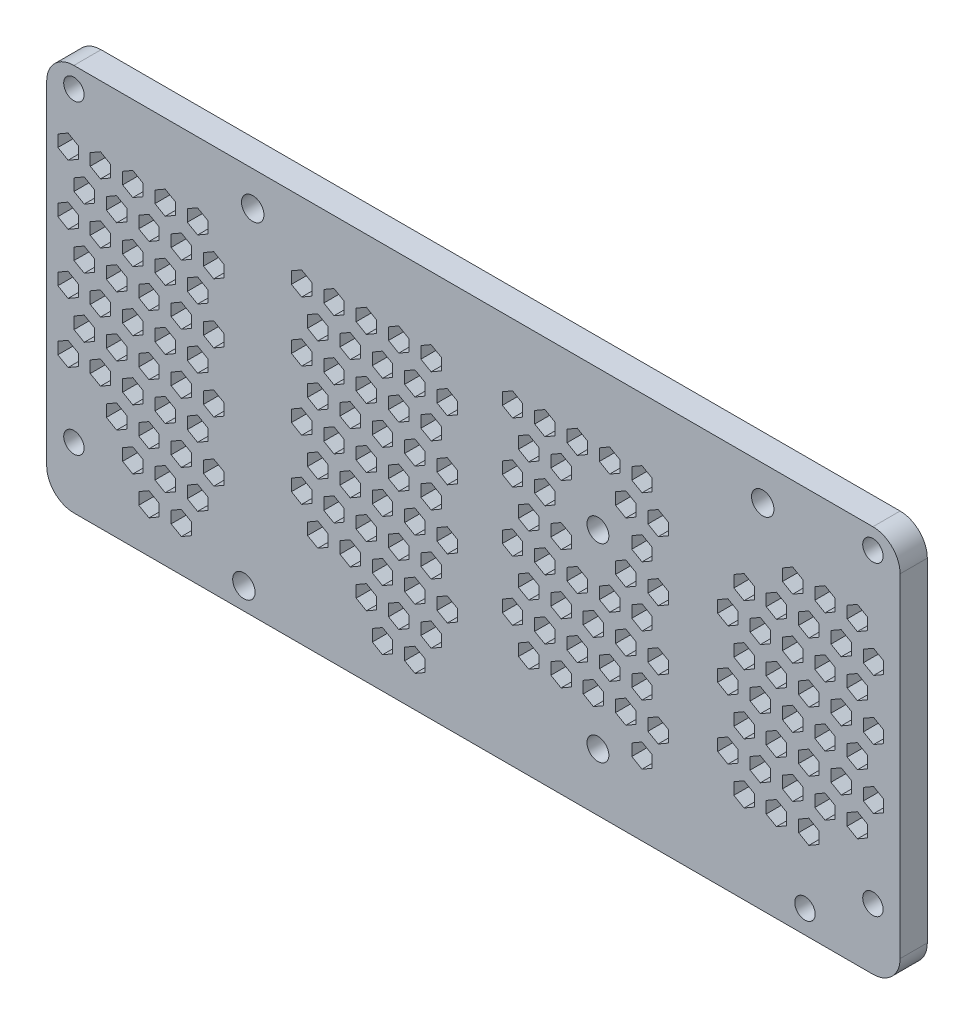
from build123d import *

# Parameters (mm, degrees)
SKETCH1_R           = 1.5
SKETCH1_R_2         = 1.65
SKETCH1_R_3         = 1.6081
BOSS_EXTRUDE5_DEPTH = 4


with BuildPart() as part:
    # Sketch1 → Boss-Extrude5 (new body)
    with BuildSketch(Plane.XY):
        with BuildLine():
            Line((-44, 22.584801725), (73.5, 22.584801725))
            ThreePointArc((73.5, 22.584801725), (76.328427125, 21.41322885), (77.5, 18.584801725))
            Line((77.5, 18.584801725), (77.5, -30.415198275))
            ThreePointArc((77.5, -30.415198275), (76.328427125, -33.2436254), (73.5, -34.415198275))
            Line((73.5, -34.415198275), (-44, -34.415198275))
            ThreePointArc((-44, -34.415198275), (-46.828427125, -33.2436254), (-48, -30.415198275))
            Line((-48, -30.415198275), (-48, 18.584801725))
            ThreePointArc((-48, 18.584801725), (-46.828427125, 21.41322885), (-44, 22.584801725))
        make_face()
        with Locations((-44, 19.584801725)):
            Circle(SKETCH1_R, mode=Mode.SUBTRACT)
        with Locations((73.5, 19.584801725)):
            Circle(SKETCH1_R, mode=Mode.SUBTRACT)
        with Locations((-44, -25.415198275)):
            Circle(SKETCH1_R, mode=Mode.SUBTRACT)
        with Locations((73.5, -25.415198275)):
            Circle(SKETCH1_R, mode=Mode.SUBTRACT)
        with Locations((-17.7, 17.511359812)):
            Circle(SKETCH1_R_2, mode=Mode.SUBTRACT)
        with Locations((-19, -31.188640188)):
            Circle(SKETCH1_R_2, mode=Mode.SUBTRACT)
        with Locations((57.3, 17.511359812)):
            Circle(SKETCH1_R_2, mode=Mode.SUBTRACT)
        with Locations((63.5088, -31.010440188)):
            Circle(SKETCH1_R, mode=Mode.SUBTRACT)
        with Locations((33.0607, -25.932240188)):
            Circle(SKETCH1_R_3, mode=Mode.SUBTRACT)
        with Locations((33.0607, 1.976659812)):
            Circle(SKETCH1_R_3, mode=Mode.SUBTRACT)
        Polygon((-44.8542361, 13.546846171), (-46.3542361, 12.680820767), (-46.3542361, 10.948769959), (-44.8542361, 10.082744555), (-43.3542361, 10.948769959), (-43.3542361, 12.680820767), align=None, mode=Mode.SUBTRACT)
        Polygon((-42.478591753, 9.144922382), (-43.978591753, 8.278896978), (-43.978591753, 6.546846171), (-42.478591753, 5.680820767), (-40.978591753, 6.546846171), (-40.978591753, 8.278896978), align=None, mode=Mode.SUBTRACT)
        Polygon((-40.0942361, 13.546846171), (-41.5942361, 12.680820767), (-41.5942361, 10.948769959), (-40.0942361, 10.082744555), (-38.5942361, 10.948769959), (-38.5942361, 12.680820767), align=None, mode=Mode.SUBTRACT)
        Polygon((-37.718591753, 9.144922382), (-39.218591753, 8.278896978), (-39.218591753, 6.546846171), (-37.718591753, 5.680820767), (-36.218591753, 6.546846171), (-36.218591753, 8.278896978), align=None, mode=Mode.SUBTRACT)
        Polygon((-35.3342361, 13.546846171), (-36.8342361, 12.680820767), (-36.8342361, 10.948769959), (-35.3342361, 10.082744555), (-33.8342361, 10.948769959), (-33.8342361, 12.680820767), align=None, mode=Mode.SUBTRACT)
        Polygon((-32.958591753, 9.144922382), (-34.458591753, 8.278896978), (-34.458591753, 6.546846171), (-32.958591753, 5.680820767), (-31.458591753, 6.546846171), (-31.458591753, 8.278896978), align=None, mode=Mode.SUBTRACT)
        Polygon((-30.5742361, 13.546846171), (-32.0742361, 12.680820767), (-32.0742361, 10.948769959), (-30.5742361, 10.082744555), (-29.0742361, 10.948769959), (-29.0742361, 12.680820767), align=None, mode=Mode.SUBTRACT)
        Polygon((-28.198591753, 9.144922382), (-29.698591753, 8.278896978), (-29.698591753, 6.546846171), (-28.198591753, 5.680820767), (-26.698591753, 6.546846171), (-26.698591753, 8.278896978), align=None, mode=Mode.SUBTRACT)
        Polygon((-25.8142361, 13.546846171), (-27.3142361, 12.680820767), (-27.3142361, 10.948769959), (-25.8142361, 10.082744555), (-24.3142361, 10.948769959), (-24.3142361, 12.680820767), align=None, mode=Mode.SUBTRACT)
        Polygon((-23.438591753, 9.144922382), (-24.938591753, 8.278896978), (-24.938591753, 6.546846171), (-23.438591753, 5.680820767), (-21.938591753, 6.546846171), (-21.938591753, 8.278896978), align=None, mode=Mode.SUBTRACT)
        Polygon((-40.0942361, 4.746846171), (-41.5942361, 3.880820767), (-41.5942361, 2.148769959), (-40.0942361, 1.282744555), (-38.5942361, 2.148769959), (-38.5942361, 3.880820767), align=None, mode=Mode.SUBTRACT)
        Polygon((-37.718591753, 0.344922382), (-39.218591753, -0.521103022), (-39.218591753, -2.253153829), (-37.718591753, -3.119179233), (-36.218591753, -2.253153829), (-36.218591753, -0.521103022), align=None, mode=Mode.SUBTRACT)
        Polygon((-35.3342361, 4.746846171), (-36.8342361, 3.880820767), (-36.8342361, 2.148769959), (-35.3342361, 1.282744555), (-33.8342361, 2.148769959), (-33.8342361, 3.880820767), align=None, mode=Mode.SUBTRACT)
        Polygon((-32.958591753, 0.344922382), (-34.458591753, -0.521103022), (-34.458591753, -2.253153829), (-32.958591753, -3.119179233), (-31.458591753, -2.253153829), (-31.458591753, -0.521103022), align=None, mode=Mode.SUBTRACT)
        Polygon((-30.5742361, 4.746846171), (-32.0742361, 3.880820767), (-32.0742361, 2.148769959), (-30.5742361, 1.282744555), (-29.0742361, 2.148769959), (-29.0742361, 3.880820767), align=None, mode=Mode.SUBTRACT)
        Polygon((-28.198591753, 0.344922382), (-29.698591753, -0.521103022), (-29.698591753, -2.253153829), (-28.198591753, -3.119179233), (-26.698591753, -2.253153829), (-26.698591753, -0.521103022), align=None, mode=Mode.SUBTRACT)
        Polygon((-25.8142361, 4.746846171), (-27.3142361, 3.880820767), (-27.3142361, 2.148769959), (-25.8142361, 1.282744555), (-24.3142361, 2.148769959), (-24.3142361, 3.880820767), align=None, mode=Mode.SUBTRACT)
        Polygon((-23.438591753, 0.344922382), (-24.938591753, -0.521103022), (-24.938591753, -2.253153829), (-23.438591753, -3.119179233), (-21.938591753, -2.253153829), (-21.938591753, -0.521103022), align=None, mode=Mode.SUBTRACT)
        Polygon((-40.0942361, -4.053153829), (-41.5942361, -4.919179233), (-41.5942361, -6.651230041), (-40.0942361, -7.517255445), (-38.5942361, -6.651230041), (-38.5942361, -4.919179233), align=None, mode=Mode.SUBTRACT)
        Polygon((-37.718591753, -8.455077618), (-39.218591753, -9.321103022), (-39.218591753, -11.053153829), (-37.718591753, -11.919179233), (-36.218591753, -11.053153829), (-36.218591753, -9.321103022), align=None, mode=Mode.SUBTRACT)
        Polygon((-35.3342361, -4.053153829), (-36.8342361, -4.919179233), (-36.8342361, -6.651230041), (-35.3342361, -7.517255445), (-33.8342361, -6.651230041), (-33.8342361, -4.919179233), align=None, mode=Mode.SUBTRACT)
        Polygon((-32.958591753, -8.455077618), (-34.458591753, -9.321103022), (-34.458591753, -11.053153829), (-32.958591753, -11.919179233), (-31.458591753, -11.053153829), (-31.458591753, -9.321103022), align=None, mode=Mode.SUBTRACT)
        Polygon((-30.5742361, -4.053153829), (-32.0742361, -4.919179233), (-32.0742361, -6.651230041), (-30.5742361, -7.517255445), (-29.0742361, -6.651230041), (-29.0742361, -4.919179233), align=None, mode=Mode.SUBTRACT)
        Polygon((-28.198591753, -8.455077618), (-29.698591753, -9.321103022), (-29.698591753, -11.053153829), (-28.198591753, -11.919179233), (-26.698591753, -11.053153829), (-26.698591753, -9.321103022), align=None, mode=Mode.SUBTRACT)
        Polygon((-25.8142361, -4.053153829), (-27.3142361, -4.919179233), (-27.3142361, -6.651230041), (-25.8142361, -7.517255445), (-24.3142361, -6.651230041), (-24.3142361, -4.919179233), align=None, mode=Mode.SUBTRACT)
        Polygon((-23.438591753, -8.455077618), (-24.938591753, -9.321103022), (-24.938591753, -11.053153829), (-23.438591753, -11.919179233), (-21.938591753, -11.053153829), (-21.938591753, -9.321103022), align=None, mode=Mode.SUBTRACT)
        Polygon((-40.0942361, -12.853153829), (-41.5942361, -13.719179233), (-41.5942361, -15.451230041), (-40.0942361, -16.317255445), (-38.5942361, -15.451230041), (-38.5942361, -13.719179233), align=None, mode=Mode.SUBTRACT)
        Polygon((-37.718591753, -17.255077618), (-39.218591753, -18.121103022), (-39.218591753, -19.853153829), (-37.718591753, -20.719179233), (-36.218591753, -19.853153829), (-36.218591753, -18.121103022), align=None, mode=Mode.SUBTRACT)
        Polygon((-35.3342361, -12.853153829), (-36.8342361, -13.719179233), (-36.8342361, -15.451230041), (-35.3342361, -16.317255445), (-33.8342361, -15.451230041), (-33.8342361, -13.719179233), align=None, mode=Mode.SUBTRACT)
        Polygon((-32.958591753, -17.255077618), (-34.458591753, -18.121103022), (-34.458591753, -19.853153829), (-32.958591753, -20.719179233), (-31.458591753, -19.853153829), (-31.458591753, -18.121103022), align=None, mode=Mode.SUBTRACT)
        Polygon((-30.5742361, -12.853153829), (-32.0742361, -13.719179233), (-32.0742361, -15.451230041), (-30.5742361, -16.317255445), (-29.0742361, -15.451230041), (-29.0742361, -13.719179233), align=None, mode=Mode.SUBTRACT)
        Polygon((-28.198591753, -17.255077618), (-29.698591753, -18.121103022), (-29.698591753, -19.853153829), (-28.198591753, -20.719179233), (-26.698591753, -19.853153829), (-26.698591753, -18.121103022), align=None, mode=Mode.SUBTRACT)
        Polygon((-25.8142361, -12.853153829), (-27.3142361, -13.719179233), (-27.3142361, -15.451230041), (-25.8142361, -16.317255445), (-24.3142361, -15.451230041), (-24.3142361, -13.719179233), align=None, mode=Mode.SUBTRACT)
        Polygon((-23.438591753, -17.255077618), (-24.938591753, -18.121103022), (-24.938591753, -19.853153829), (-23.438591753, -20.719179233), (-21.938591753, -19.853153829), (-21.938591753, -18.121103022), align=None, mode=Mode.SUBTRACT)
        Polygon((-35.3342361, -21.653153829), (-36.8342361, -22.519179233), (-36.8342361, -24.251230041), (-35.3342361, -25.117255445), (-33.8342361, -24.251230041), (-33.8342361, -22.519179233), align=None, mode=Mode.SUBTRACT)
        Polygon((-32.958591753, -26.055077618), (-34.458591753, -26.921103022), (-34.458591753, -28.653153829), (-32.958591753, -29.519179233), (-31.458591753, -28.653153829), (-31.458591753, -26.921103022), align=None, mode=Mode.SUBTRACT)
        Polygon((-30.5742361, -21.653153829), (-32.0742361, -22.519179233), (-32.0742361, -24.251230041), (-30.5742361, -25.117255445), (-29.0742361, -24.251230041), (-29.0742361, -22.519179233), align=None, mode=Mode.SUBTRACT)
        Polygon((-28.198591753, -26.055077618), (-29.698591753, -26.921103022), (-29.698591753, -28.653153829), (-28.198591753, -29.519179233), (-26.698591753, -28.653153829), (-26.698591753, -26.921103022), align=None, mode=Mode.SUBTRACT)
        Polygon((-25.8142361, -21.653153829), (-27.3142361, -22.519179233), (-27.3142361, -24.251230041), (-25.8142361, -25.117255445), (-24.3142361, -24.251230041), (-24.3142361, -22.519179233), align=None, mode=Mode.SUBTRACT)
        Polygon((-44.8542361, 4.746846171), (-46.3542361, 3.880820767), (-46.3542361, 2.148769959), (-44.8542361, 1.282744555), (-43.3542361, 2.148769959), (-43.3542361, 3.880820767), align=None, mode=Mode.SUBTRACT)
        Polygon((-42.478591753, 0.344922382), (-43.978591753, -0.521103022), (-43.978591753, -2.253153829), (-42.478591753, -3.119179233), (-40.978591753, -2.253153829), (-40.978591753, -0.521103022), align=None, mode=Mode.SUBTRACT)
        Polygon((-44.8542361, -4.053153829), (-46.3542361, -4.919179233), (-46.3542361, -6.651230041), (-44.8542361, -7.517255445), (-43.3542361, -6.651230041), (-43.3542361, -4.919179233), align=None, mode=Mode.SUBTRACT)
        Polygon((-42.478591753, -8.455077618), (-43.978591753, -9.321103022), (-43.978591753, -11.053153829), (-42.478591753, -11.919179233), (-40.978591753, -11.053153829), (-40.978591753, -9.321103022), align=None, mode=Mode.SUBTRACT)
        Polygon((-44.8542361, -12.853153829), (-46.3542361, -13.719179233), (-46.3542361, -15.451230041), (-44.8542361, -16.317255445), (-43.3542361, -15.451230041), (-43.3542361, -13.719179233), align=None, mode=Mode.SUBTRACT)
        Polygon((54.553412934, 7.152031374), (53.053412934, 6.28600597), (53.053412934, 4.553955163), (54.553412934, 3.687929759), (56.053412934, 4.553955163), (56.053412934, 6.28600597), align=None, mode=Mode.SUBTRACT)
        Polygon((59.313412934, 7.152031374), (57.813412934, 6.28600597), (57.813412934, 4.553955163), (59.313412934, 3.687929759), (60.813412934, 4.553955163), (60.813412934, 6.28600597), align=None, mode=Mode.SUBTRACT)
        Polygon((61.697768587, 11.553955163), (60.197768587, 10.687929759), (60.197768587, 8.955878952), (61.697768587, 8.089853548), (63.197768587, 8.955878952), (63.197768587, 10.687929759), align=None, mode=Mode.SUBTRACT)
        Polygon((64.073412934, 7.152031374), (62.573412934, 6.28600597), (62.573412934, 4.553955163), (64.073412934, 3.687929759), (65.573412934, 4.553955163), (65.573412934, 6.28600597), align=None, mode=Mode.SUBTRACT)
        Polygon((66.457768587, 11.553955163), (64.957768587, 10.687929759), (64.957768587, 8.955878952), (66.457768587, 8.089853548), (67.957768587, 8.955878952), (67.957768587, 10.687929759), align=None, mode=Mode.SUBTRACT)
        Polygon((68.833412934, 7.152031374), (67.333412934, 6.28600597), (67.333412934, 4.553955163), (68.833412934, 3.687929759), (70.333412934, 4.553955163), (70.333412934, 6.28600597), align=None, mode=Mode.SUBTRACT)
        Polygon((71.217768587, 11.553955163), (69.717768587, 10.687929759), (69.717768587, 8.955878952), (71.217768587, 8.089853548), (72.717768587, 8.955878952), (72.717768587, 10.687929759), align=None, mode=Mode.SUBTRACT)
        Polygon((73.593412934, 7.152031374), (72.093412934, 6.28600597), (72.093412934, 4.553955163), (73.593412934, 3.687929759), (75.093412934, 4.553955163), (75.093412934, 6.28600597), align=None, mode=Mode.SUBTRACT)
        Polygon((56.937768587, 2.753955163), (55.437768587, 1.887929759), (55.437768587, 0.155878952), (56.937768587, -0.710146452), (58.437768587, 0.155878952), (58.437768587, 1.887929759), align=None, mode=Mode.SUBTRACT)
        Polygon((59.313412934, -1.647968626), (57.813412934, -2.51399403), (57.813412934, -4.246044837), (59.313412934, -5.112070241), (60.813412934, -4.246044837), (60.813412934, -2.51399403), align=None, mode=Mode.SUBTRACT)
        Polygon((61.697768587, 2.753955163), (60.197768587, 1.887929759), (60.197768587, 0.155878952), (61.697768587, -0.710146452), (63.197768587, 0.155878952), (63.197768587, 1.887929759), align=None, mode=Mode.SUBTRACT)
        Polygon((64.073412934, -1.647968626), (62.573412934, -2.51399403), (62.573412934, -4.246044837), (64.073412934, -5.112070241), (65.573412934, -4.246044837), (65.573412934, -2.51399403), align=None, mode=Mode.SUBTRACT)
        Polygon((66.457768587, 2.753955163), (64.957768587, 1.887929759), (64.957768587, 0.155878952), (66.457768587, -0.710146452), (67.957768587, 0.155878952), (67.957768587, 1.887929759), align=None, mode=Mode.SUBTRACT)
        Polygon((68.833412934, -1.647968626), (67.333412934, -2.51399403), (67.333412934, -4.246044837), (68.833412934, -5.112070241), (70.333412934, -4.246044837), (70.333412934, -2.51399403), align=None, mode=Mode.SUBTRACT)
        Polygon((71.217768587, 2.753955163), (69.717768587, 1.887929759), (69.717768587, 0.155878952), (71.217768587, -0.710146452), (72.717768587, 0.155878952), (72.717768587, 1.887929759), align=None, mode=Mode.SUBTRACT)
        Polygon((73.593412934, -1.647968626), (72.093412934, -2.51399403), (72.093412934, -4.246044837), (73.593412934, -5.112070241), (75.093412934, -4.246044837), (75.093412934, -2.51399403), align=None, mode=Mode.SUBTRACT)
        Polygon((56.937768587, -6.046044837), (55.437768587, -6.912070241), (55.437768587, -8.644121048), (56.937768587, -9.510146452), (58.437768587, -8.644121048), (58.437768587, -6.912070241), align=None, mode=Mode.SUBTRACT)
        Polygon((59.313412934, -10.447968626), (57.813412934, -11.31399403), (57.813412934, -13.046044837), (59.313412934, -13.912070241), (60.813412934, -13.046044837), (60.813412934, -11.31399403), align=None, mode=Mode.SUBTRACT)
        Polygon((61.697768587, -6.046044837), (60.197768587, -6.912070241), (60.197768587, -8.644121048), (61.697768587, -9.510146452), (63.197768587, -8.644121048), (63.197768587, -6.912070241), align=None, mode=Mode.SUBTRACT)
        Polygon((64.073412934, -10.447968626), (62.573412934, -11.31399403), (62.573412934, -13.046044837), (64.073412934, -13.912070241), (65.573412934, -13.046044837), (65.573412934, -11.31399403), align=None, mode=Mode.SUBTRACT)
        Polygon((66.457768587, -6.046044837), (64.957768587, -6.912070241), (64.957768587, -8.644121048), (66.457768587, -9.510146452), (67.957768587, -8.644121048), (67.957768587, -6.912070241), align=None, mode=Mode.SUBTRACT)
        Polygon((68.833412934, -10.447968626), (67.333412934, -11.31399403), (67.333412934, -13.046044837), (68.833412934, -13.912070241), (70.333412934, -13.046044837), (70.333412934, -11.31399403), align=None, mode=Mode.SUBTRACT)
        Polygon((71.217768587, -6.046044837), (69.717768587, -6.912070241), (69.717768587, -8.644121048), (71.217768587, -9.510146452), (72.717768587, -8.644121048), (72.717768587, -6.912070241), align=None, mode=Mode.SUBTRACT)
        Polygon((73.593412934, -10.447968626), (72.093412934, -11.31399403), (72.093412934, -13.046044837), (73.593412934, -13.912070241), (75.093412934, -13.046044837), (75.093412934, -11.31399403), align=None, mode=Mode.SUBTRACT)
        Polygon((56.937768587, -14.846044837), (55.437768587, -15.712070241), (55.437768587, -17.444121048), (56.937768587, -18.310146452), (58.437768587, -17.444121048), (58.437768587, -15.712070241), align=None, mode=Mode.SUBTRACT)
        Polygon((59.313412934, -19.247968626), (57.813412934, -20.11399403), (57.813412934, -21.846044837), (59.313412934, -22.712070241), (60.813412934, -21.846044837), (60.813412934, -20.11399403), align=None, mode=Mode.SUBTRACT)
        Polygon((61.697768587, -14.846044837), (60.197768587, -15.712070241), (60.197768587, -17.444121048), (61.697768587, -18.310146452), (63.197768587, -17.444121048), (63.197768587, -15.712070241), align=None, mode=Mode.SUBTRACT)
        Polygon((64.073412934, -19.247968626), (62.573412934, -20.11399403), (62.573412934, -21.846044837), (64.073412934, -22.712070241), (65.573412934, -21.846044837), (65.573412934, -20.11399403), align=None, mode=Mode.SUBTRACT)
        Polygon((66.457768587, -14.846044837), (64.957768587, -15.712070241), (64.957768587, -17.444121048), (66.457768587, -18.310146452), (67.957768587, -17.444121048), (67.957768587, -15.712070241), align=None, mode=Mode.SUBTRACT)
        Polygon((71.217768587, -14.846044837), (69.717768587, -15.712070241), (69.717768587, -17.444121048), (71.217768587, -18.310146452), (72.717768587, -17.444121048), (72.717768587, -15.712070241), align=None, mode=Mode.SUBTRACT)
        Polygon((52.177768587, 2.753955163), (50.677768587, 1.887929759), (50.677768587, 0.155878952), (52.177768587, -0.710146452), (53.677768587, 0.155878952), (53.677768587, 1.887929759), align=None, mode=Mode.SUBTRACT)
        Polygon((54.553412934, -1.647968626), (53.053412934, -2.51399403), (53.053412934, -4.246044837), (54.553412934, -5.112070241), (56.053412934, -4.246044837), (56.053412934, -2.51399403), align=None, mode=Mode.SUBTRACT)
        Polygon((52.177768587, -6.046044837), (50.677768587, -6.912070241), (50.677768587, -8.644121048), (52.177768587, -9.510146452), (53.677768587, -8.644121048), (53.677768587, -6.912070241), align=None, mode=Mode.SUBTRACT)
        Polygon((54.553412934, -10.447968626), (53.053412934, -11.31399403), (53.053412934, -13.046044837), (54.553412934, -13.912070241), (56.053412934, -13.046044837), (56.053412934, -11.31399403), align=None, mode=Mode.SUBTRACT)
        Polygon((52.177768587, -14.846044837), (50.677768587, -15.712070241), (50.677768587, -17.444121048), (52.177768587, -18.310146452), (53.677768587, -17.444121048), (53.677768587, -15.712070241), align=None, mode=Mode.SUBTRACT)
        Polygon((54.553412934, -19.247968626), (53.053412934, -20.11399403), (53.053412934, -21.846044837), (54.553412934, -22.712070241), (56.053412934, -21.846044837), (56.053412934, -20.11399403), align=None, mode=Mode.SUBTRACT)
        Polygon((-10.509250981, 13.292308193), (-12.009250981, 12.426282789), (-12.009250981, 10.694231982), (-10.509250981, 9.828206578), (-9.009250981, 10.694231982), (-9.009250981, 12.426282789), align=None, mode=Mode.SUBTRACT)
        Polygon((-8.133606634, 8.890384404), (-9.633606634, 8.024359001), (-9.633606634, 6.292308193), (-8.133606634, 5.426282789), (-6.633606634, 6.292308193), (-6.633606634, 8.024359001), align=None, mode=Mode.SUBTRACT)
        Polygon((-5.749250981, 13.292308193), (-7.249250981, 12.426282789), (-7.249250981, 10.694231982), (-5.749250981, 9.828206578), (-4.249250981, 10.694231982), (-4.249250981, 12.426282789), align=None, mode=Mode.SUBTRACT)
        Polygon((-3.373606634, 8.890384404), (-4.873606634, 8.024359001), (-4.873606634, 6.292308193), (-3.373606634, 5.426282789), (-1.873606634, 6.292308193), (-1.873606634, 8.024359001), align=None, mode=Mode.SUBTRACT)
        Polygon((-0.989250981, 13.292308193), (-2.489250981, 12.426282789), (-2.489250981, 10.694231982), (-0.989250981, 9.828206578), (0.510749019, 10.694231982), (0.510749019, 12.426282789), align=None, mode=Mode.SUBTRACT)
        Polygon((1.386393366, 8.890384404), (-0.113606634, 8.024359001), (-0.113606634, 6.292308193), (1.386393366, 5.426282789), (2.886393366, 6.292308193), (2.886393366, 8.024359001), align=None, mode=Mode.SUBTRACT)
        Polygon((3.770749019, 13.292308193), (2.270749019, 12.426282789), (2.270749019, 10.694231982), (3.770749019, 9.828206578), (5.270749019, 10.694231982), (5.270749019, 12.426282789), align=None, mode=Mode.SUBTRACT)
        Polygon((6.146393366, 8.890384404), (4.646393366, 8.024359001), (4.646393366, 6.292308193), (6.146393366, 5.426282789), (7.646393366, 6.292308193), (7.646393366, 8.024359001), align=None, mode=Mode.SUBTRACT)
        Polygon((8.530749019, 13.292308193), (7.030749019, 12.426282789), (7.030749019, 10.694231982), (8.530749019, 9.828206578), (10.030749019, 10.694231982), (10.030749019, 12.426282789), align=None, mode=Mode.SUBTRACT)
        Polygon((10.906393366, 8.890384404), (9.406393366, 8.024359001), (9.406393366, 6.292308193), (10.906393366, 5.426282789), (12.406393366, 6.292308193), (12.406393366, 8.024359001), align=None, mode=Mode.SUBTRACT)
        Polygon((-5.749250981, 4.492308193), (-7.249250981, 3.626282789), (-7.249250981, 1.894231982), (-5.749250981, 1.028206578), (-4.249250981, 1.894231982), (-4.249250981, 3.626282789), align=None, mode=Mode.SUBTRACT)
        Polygon((-3.373606634, 0.090384404), (-4.873606634, -0.775640999), (-4.873606634, -2.507691807), (-3.373606634, -3.373717211), (-1.873606634, -2.507691807), (-1.873606634, -0.775640999), align=None, mode=Mode.SUBTRACT)
        Polygon((-0.989250981, 4.492308193), (-2.489250981, 3.626282789), (-2.489250981, 1.894231982), (-0.989250981, 1.028206578), (0.510749019, 1.894231982), (0.510749019, 3.626282789), align=None, mode=Mode.SUBTRACT)
        Polygon((1.386393366, 0.090384404), (-0.113606634, -0.775640999), (-0.113606634, -2.507691807), (1.386393366, -3.373717211), (2.886393366, -2.507691807), (2.886393366, -0.775640999), align=None, mode=Mode.SUBTRACT)
        Polygon((3.770749019, 4.492308193), (2.270749019, 3.626282789), (2.270749019, 1.894231982), (3.770749019, 1.028206578), (5.270749019, 1.894231982), (5.270749019, 3.626282789), align=None, mode=Mode.SUBTRACT)
        Polygon((6.146393366, 0.090384404), (4.646393366, -0.775640999), (4.646393366, -2.507691807), (6.146393366, -3.373717211), (7.646393366, -2.507691807), (7.646393366, -0.775640999), align=None, mode=Mode.SUBTRACT)
        Polygon((8.530749019, 4.492308193), (7.030749019, 3.626282789), (7.030749019, 1.894231982), (8.530749019, 1.028206578), (10.030749019, 1.894231982), (10.030749019, 3.626282789), align=None, mode=Mode.SUBTRACT)
        Polygon((10.906393366, 0.090384404), (9.406393366, -0.775640999), (9.406393366, -2.507691807), (10.906393366, -3.373717211), (12.406393366, -2.507691807), (12.406393366, -0.775640999), align=None, mode=Mode.SUBTRACT)
        Polygon((-5.749250981, -4.307691807), (-7.249250981, -5.173717211), (-7.249250981, -6.905768018), (-5.749250981, -7.771793422), (-4.249250981, -6.905768018), (-4.249250981, -5.173717211), align=None, mode=Mode.SUBTRACT)
        Polygon((-3.373606634, -8.709615596), (-4.873606634, -9.575640999), (-4.873606634, -11.307691807), (-3.373606634, -12.173717211), (-1.873606634, -11.307691807), (-1.873606634, -9.575640999), align=None, mode=Mode.SUBTRACT)
        Polygon((-0.989250981, -4.307691807), (-2.489250981, -5.173717211), (-2.489250981, -6.905768018), (-0.989250981, -7.771793422), (0.510749019, -6.905768018), (0.510749019, -5.173717211), align=None, mode=Mode.SUBTRACT)
        Polygon((1.386393366, -8.709615596), (-0.113606634, -9.575640999), (-0.113606634, -11.307691807), (1.386393366, -12.173717211), (2.886393366, -11.307691807), (2.886393366, -9.575640999), align=None, mode=Mode.SUBTRACT)
        Polygon((3.770749019, -4.307691807), (2.270749019, -5.173717211), (2.270749019, -6.905768018), (3.770749019, -7.771793422), (5.270749019, -6.905768018), (5.270749019, -5.173717211), align=None, mode=Mode.SUBTRACT)
        Polygon((6.146393366, -8.709615596), (4.646393366, -9.575640999), (4.646393366, -11.307691807), (6.146393366, -12.173717211), (7.646393366, -11.307691807), (7.646393366, -9.575640999), align=None, mode=Mode.SUBTRACT)
        Polygon((8.530749019, -4.307691807), (7.030749019, -5.173717211), (7.030749019, -6.905768018), (8.530749019, -7.771793422), (10.030749019, -6.905768018), (10.030749019, -5.173717211), align=None, mode=Mode.SUBTRACT)
        Polygon((10.906393366, -8.709615596), (9.406393366, -9.575640999), (9.406393366, -11.307691807), (10.906393366, -12.173717211), (12.406393366, -11.307691807), (12.406393366, -9.575640999), align=None, mode=Mode.SUBTRACT)
        Polygon((-5.749250981, -13.107691807), (-7.249250981, -13.973717211), (-7.249250981, -15.705768018), (-5.749250981, -16.571793422), (-4.249250981, -15.705768018), (-4.249250981, -13.973717211), align=None, mode=Mode.SUBTRACT)
        Polygon((-3.373606634, -17.509615596), (-4.873606634, -18.375640999), (-4.873606634, -20.107691807), (-3.373606634, -20.973717211), (-1.873606634, -20.107691807), (-1.873606634, -18.375640999), align=None, mode=Mode.SUBTRACT)
        Polygon((-0.989250981, -13.107691807), (-2.489250981, -13.973717211), (-2.489250981, -15.705768018), (-0.989250981, -16.571793422), (0.510749019, -15.705768018), (0.510749019, -13.973717211), align=None, mode=Mode.SUBTRACT)
        Polygon((1.386393366, -17.509615596), (-0.113606634, -18.375640999), (-0.113606634, -20.107691807), (1.386393366, -20.973717211), (2.886393366, -20.107691807), (2.886393366, -18.375640999), align=None, mode=Mode.SUBTRACT)
        Polygon((3.770749019, -13.107691807), (2.270749019, -13.973717211), (2.270749019, -15.705768018), (3.770749019, -16.571793422), (5.270749019, -15.705768018), (5.270749019, -13.973717211), align=None, mode=Mode.SUBTRACT)
        Polygon((6.146393366, -17.509615596), (4.646393366, -18.375640999), (4.646393366, -20.107691807), (6.146393366, -20.973717211), (7.646393366, -20.107691807), (7.646393366, -18.375640999), align=None, mode=Mode.SUBTRACT)
        Polygon((8.530749019, -13.107691807), (7.030749019, -13.973717211), (7.030749019, -15.705768018), (8.530749019, -16.571793422), (10.030749019, -15.705768018), (10.030749019, -13.973717211), align=None, mode=Mode.SUBTRACT)
        Polygon((10.906393366, -17.509615596), (9.406393366, -18.375640999), (9.406393366, -20.107691807), (10.906393366, -20.973717211), (12.406393366, -20.107691807), (12.406393366, -18.375640999), align=None, mode=Mode.SUBTRACT)
        Polygon((-0.989250981, -21.907691807), (-2.489250981, -22.773717211), (-2.489250981, -24.505768018), (-0.989250981, -25.371793422), (0.510749019, -24.505768018), (0.510749019, -22.773717211), align=None, mode=Mode.SUBTRACT)
        Polygon((1.386393366, -26.309615596), (-0.113606634, -27.175640999), (-0.113606634, -28.907691807), (1.386393366, -29.773717211), (2.886393366, -28.907691807), (2.886393366, -27.175640999), align=None, mode=Mode.SUBTRACT)
        Polygon((3.770749019, -21.907691807), (2.270749019, -22.773717211), (2.270749019, -24.505768018), (3.770749019, -25.371793422), (5.270749019, -24.505768018), (5.270749019, -22.773717211), align=None, mode=Mode.SUBTRACT)
        Polygon((6.146393366, -26.309615596), (4.646393366, -27.175640999), (4.646393366, -28.907691807), (6.146393366, -29.773717211), (7.646393366, -28.907691807), (7.646393366, -27.175640999), align=None, mode=Mode.SUBTRACT)
        Polygon((8.530749019, -21.907691807), (7.030749019, -22.773717211), (7.030749019, -24.505768018), (8.530749019, -25.371793422), (10.030749019, -24.505768018), (10.030749019, -22.773717211), align=None, mode=Mode.SUBTRACT)
        Polygon((-10.509250981, 4.492308193), (-12.009250981, 3.626282789), (-12.009250981, 1.894231982), (-10.509250981, 1.028206578), (-9.009250981, 1.894231982), (-9.009250981, 3.626282789), align=None, mode=Mode.SUBTRACT)
        Polygon((-8.133606634, 0.090384404), (-9.633606634, -0.775640999), (-9.633606634, -2.507691807), (-8.133606634, -3.373717211), (-6.633606634, -2.507691807), (-6.633606634, -0.775640999), align=None, mode=Mode.SUBTRACT)
        Polygon((-10.509250981, -4.307691807), (-12.009250981, -5.173717211), (-12.009250981, -6.905768018), (-10.509250981, -7.771793422), (-9.009250981, -6.905768018), (-9.009250981, -5.173717211), align=None, mode=Mode.SUBTRACT)
        Polygon((-8.133606634, -8.709615596), (-9.633606634, -9.575640999), (-9.633606634, -11.307691807), (-8.133606634, -12.173717211), (-6.633606634, -11.307691807), (-6.633606634, -9.575640999), align=None, mode=Mode.SUBTRACT)
        Polygon((-10.509250981, -13.107691807), (-12.009250981, -13.973717211), (-12.009250981, -15.705768018), (-10.509250981, -16.571793422), (-9.009250981, -15.705768018), (-9.009250981, -13.973717211), align=None, mode=Mode.SUBTRACT)
        Polygon((-8.133606634, -17.509615596), (-9.633606634, -18.375640999), (-9.633606634, -20.107691807), (-8.133606634, -20.973717211), (-6.633606634, -20.107691807), (-6.633606634, -18.375640999), align=None, mode=Mode.SUBTRACT)
        Polygon((20.504407611, 13.391172594), (19.004407611, 12.525147191), (19.004407611, 10.793096383), (20.504407611, 9.927070979), (22.004407611, 10.793096383), (22.004407611, 12.525147191), align=None, mode=Mode.SUBTRACT)
        Polygon((22.880051958, 8.989248806), (21.380051958, 8.123223402), (21.380051958, 6.391172594), (22.880051958, 5.525147191), (24.380051958, 6.391172594), (24.380051958, 8.123223402), align=None, mode=Mode.SUBTRACT)
        Polygon((25.264407611, 13.391172594), (23.764407611, 12.525147191), (23.764407611, 10.793096383), (25.264407611, 9.927070979), (26.764407611, 10.793096383), (26.764407611, 12.525147191), align=None, mode=Mode.SUBTRACT)
        Polygon((27.640051958, 8.989248806), (26.140051958, 8.123223402), (26.140051958, 6.391172594), (27.640051958, 5.525147191), (29.140051958, 6.391172594), (29.140051958, 8.123223402), align=None, mode=Mode.SUBTRACT)
        Polygon((30.024407611, 13.391172594), (28.524407611, 12.525147191), (28.524407611, 10.793096383), (30.024407611, 9.927070979), (31.524407611, 10.793096383), (31.524407611, 12.525147191), align=None, mode=Mode.SUBTRACT)
        Polygon((34.784407611, 13.391172594), (33.284407611, 12.525147191), (33.284407611, 10.793096383), (34.784407611, 9.927070979), (36.284407611, 10.793096383), (36.284407611, 12.525147191), align=None, mode=Mode.SUBTRACT)
        Polygon((37.160051958, 8.989248806), (35.660051958, 8.123223402), (35.660051958, 6.391172594), (37.160051958, 5.525147191), (38.660051958, 6.391172594), (38.660051958, 8.123223402), align=None, mode=Mode.SUBTRACT)
        Polygon((39.544407611, 13.391172594), (38.044407611, 12.525147191), (38.044407611, 10.793096383), (39.544407611, 9.927070979), (41.044407611, 10.793096383), (41.044407611, 12.525147191), align=None, mode=Mode.SUBTRACT)
        Polygon((41.920051958, 8.989248806), (40.420051958, 8.123223402), (40.420051958, 6.391172594), (41.920051958, 5.525147191), (43.420051958, 6.391172594), (43.420051958, 8.123223402), align=None, mode=Mode.SUBTRACT)
        Polygon((25.264407611, 4.591172594), (23.764407611, 3.725147191), (23.764407611, 1.993096383), (25.264407611, 1.127070979), (26.764407611, 1.993096383), (26.764407611, 3.725147191), align=None, mode=Mode.SUBTRACT)
        Polygon((27.640051958, 0.189248806), (26.140051958, -0.676776598), (26.140051958, -2.408827406), (27.640051958, -3.274852809), (29.140051958, -2.408827406), (29.140051958, -0.676776598), align=None, mode=Mode.SUBTRACT)
        Polygon((37.160051958, 0.189248806), (35.660051958, -0.676776598), (35.660051958, -2.408827406), (37.160051958, -3.274852809), (38.660051958, -2.408827406), (38.660051958, -0.676776598), align=None, mode=Mode.SUBTRACT)
        Polygon((39.544407611, 4.591172594), (38.044407611, 3.725147191), (38.044407611, 1.993096383), (39.544407611, 1.127070979), (41.044407611, 1.993096383), (41.044407611, 3.725147191), align=None, mode=Mode.SUBTRACT)
        Polygon((41.920051958, 0.189248806), (40.420051958, -0.676776598), (40.420051958, -2.408827406), (41.920051958, -3.274852809), (43.420051958, -2.408827406), (43.420051958, -0.676776598), align=None, mode=Mode.SUBTRACT)
        Polygon((25.264407611, -4.208827406), (23.764407611, -5.074852809), (23.764407611, -6.806903617), (25.264407611, -7.672929021), (26.764407611, -6.806903617), (26.764407611, -5.074852809), align=None, mode=Mode.SUBTRACT)
        Polygon((27.640051958, -8.610751194), (26.140051958, -9.476776598), (26.140051958, -11.208827406), (27.640051958, -12.074852809), (29.140051958, -11.208827406), (29.140051958, -9.476776598), align=None, mode=Mode.SUBTRACT)
        Polygon((30.024407611, -4.208827406), (28.524407611, -5.074852809), (28.524407611, -6.806903617), (30.024407611, -7.672929021), (31.524407611, -6.806903617), (31.524407611, -5.074852809), align=None, mode=Mode.SUBTRACT)
        Polygon((32.400051958, -8.610751194), (30.900051958, -9.476776598), (30.900051958, -11.208827406), (32.400051958, -12.074852809), (33.900051958, -11.208827406), (33.900051958, -9.476776598), align=None, mode=Mode.SUBTRACT)
        Polygon((34.784407611, -4.208827406), (33.284407611, -5.074852809), (33.284407611, -6.806903617), (34.784407611, -7.672929021), (36.284407611, -6.806903617), (36.284407611, -5.074852809), align=None, mode=Mode.SUBTRACT)
        Polygon((37.160051958, -8.610751194), (35.660051958, -9.476776598), (35.660051958, -11.208827406), (37.160051958, -12.074852809), (38.660051958, -11.208827406), (38.660051958, -9.476776598), align=None, mode=Mode.SUBTRACT)
        Polygon((39.544407611, -4.208827406), (38.044407611, -5.074852809), (38.044407611, -6.806903617), (39.544407611, -7.672929021), (41.044407611, -6.806903617), (41.044407611, -5.074852809), align=None, mode=Mode.SUBTRACT)
        Polygon((41.920051958, -8.610751194), (40.420051958, -9.476776598), (40.420051958, -11.208827406), (41.920051958, -12.074852809), (43.420051958, -11.208827406), (43.420051958, -9.476776598), align=None, mode=Mode.SUBTRACT)
        Polygon((25.264407611, -13.008827406), (23.764407611, -13.874852809), (23.764407611, -15.606903617), (25.264407611, -16.472929021), (26.764407611, -15.606903617), (26.764407611, -13.874852809), align=None, mode=Mode.SUBTRACT)
        Polygon((27.640051958, -17.410751194), (26.140051958, -18.276776598), (26.140051958, -20.008827406), (27.640051958, -20.874852809), (29.140051958, -20.008827406), (29.140051958, -18.276776598), align=None, mode=Mode.SUBTRACT)
        Polygon((30.024407611, -13.008827406), (28.524407611, -13.874852809), (28.524407611, -15.606903617), (30.024407611, -16.472929021), (31.524407611, -15.606903617), (31.524407611, -13.874852809), align=None, mode=Mode.SUBTRACT)
        Polygon((32.400051958, -17.410751194), (30.900051958, -18.276776598), (30.900051958, -20.008827406), (32.400051958, -20.874852809), (33.900051958, -20.008827406), (33.900051958, -18.276776598), align=None, mode=Mode.SUBTRACT)
        Polygon((34.784407611, -13.008827406), (33.284407611, -13.874852809), (33.284407611, -15.606903617), (34.784407611, -16.472929021), (36.284407611, -15.606903617), (36.284407611, -13.874852809), align=None, mode=Mode.SUBTRACT)
        Polygon((37.160051958, -17.410751194), (35.660051958, -18.276776598), (35.660051958, -20.008827406), (37.160051958, -20.874852809), (38.660051958, -20.008827406), (38.660051958, -18.276776598), align=None, mode=Mode.SUBTRACT)
        Polygon((39.544407611, -13.008827406), (38.044407611, -13.874852809), (38.044407611, -15.606903617), (39.544407611, -16.472929021), (41.044407611, -15.606903617), (41.044407611, -13.874852809), align=None, mode=Mode.SUBTRACT)
        Polygon((41.920051958, -17.410751194), (40.420051958, -18.276776598), (40.420051958, -20.008827406), (41.920051958, -20.874852809), (43.420051958, -20.008827406), (43.420051958, -18.276776598), align=None, mode=Mode.SUBTRACT)
        Polygon((39.544407611, -21.808827406), (38.044407611, -22.674852809), (38.044407611, -24.406903617), (39.544407611, -25.272929021), (41.044407611, -24.406903617), (41.044407611, -22.674852809), align=None, mode=Mode.SUBTRACT)
        Polygon((20.504407611, 4.591172594), (19.004407611, 3.725147191), (19.004407611, 1.993096383), (20.504407611, 1.127070979), (22.004407611, 1.993096383), (22.004407611, 3.725147191), align=None, mode=Mode.SUBTRACT)
        Polygon((22.880051958, 0.189248806), (21.380051958, -0.676776598), (21.380051958, -2.408827406), (22.880051958, -3.274852809), (24.380051958, -2.408827406), (24.380051958, -0.676776598), align=None, mode=Mode.SUBTRACT)
        Polygon((20.504407611, -4.208827406), (19.004407611, -5.074852809), (19.004407611, -6.806903617), (20.504407611, -7.672929021), (22.004407611, -6.806903617), (22.004407611, -5.074852809), align=None, mode=Mode.SUBTRACT)
        Polygon((22.880051958, -8.610751194), (21.380051958, -9.476776598), (21.380051958, -11.208827406), (22.880051958, -12.074852809), (24.380051958, -11.208827406), (24.380051958, -9.476776598), align=None, mode=Mode.SUBTRACT)
        Polygon((20.504407611, -13.008827406), (19.004407611, -13.874852809), (19.004407611, -15.606903617), (20.504407611, -16.472929021), (22.004407611, -15.606903617), (22.004407611, -13.874852809), align=None, mode=Mode.SUBTRACT)
        Polygon((22.880051958, -17.410751194), (21.380051958, -18.276776598), (21.380051958, -20.008827406), (22.880051958, -20.874852809), (24.380051958, -20.008827406), (24.380051958, -18.276776598), align=None, mode=Mode.SUBTRACT)
    extrude(amount=BOSS_EXTRUDE5_DEPTH)


solid = part.part
